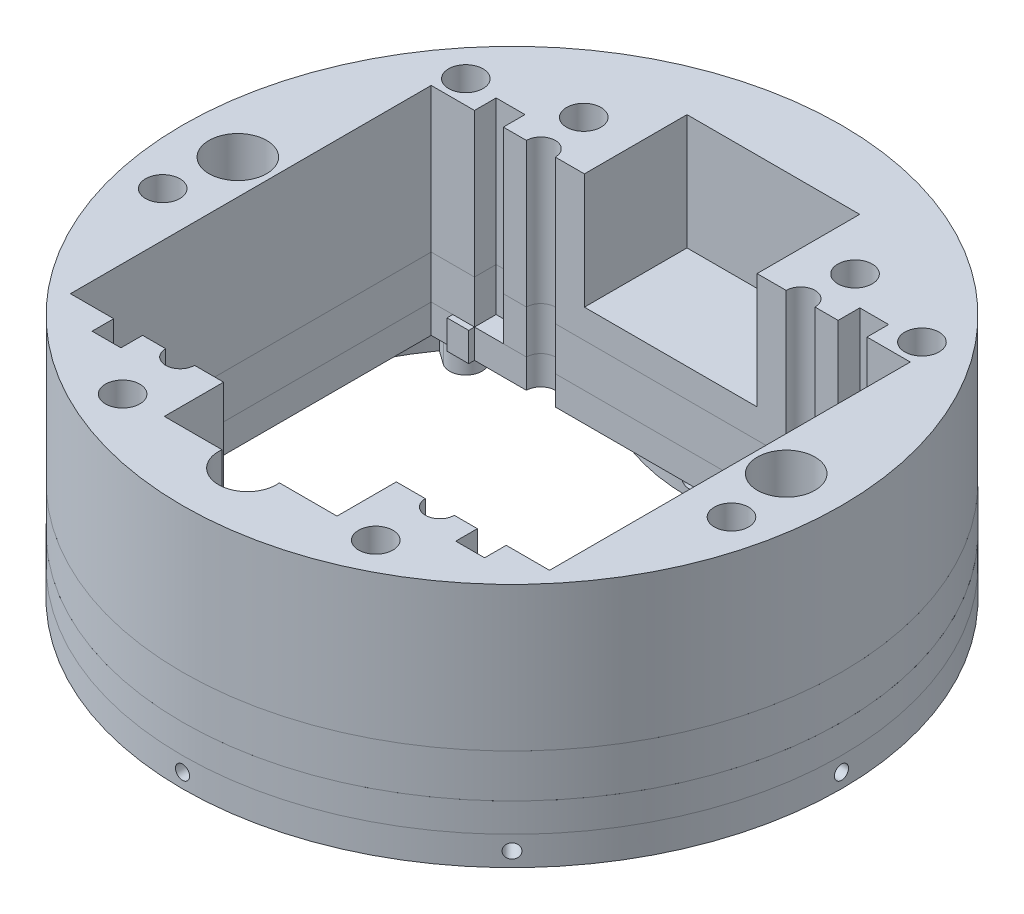
from build123d import *

# Parameters (mm, degrees)
BOSS_EXTRUDE1_DEPTH     = 12.7
CUT_EXTRUDE2_REACH      = 78.233
CUT_EXTRUDE2_END_RADIUS = 44.45
SKETCH9_R               = 1.55
BOSS_EXTRUDE3_START     = -30.48
SKETCH9_3_R             = 2.032
SKETCH9_3_R_2           = 1.55
BOSS_EXTRUDE3_DEPTH     = 4.191
BOSS_EXTRUDE4_DEPTH     = 6.35
SKETCH10_R              = 1.5875
BOSS_EXTRUDE5_DEPTH     = 6.35
SKETCH15_W              = 2.45745
SKETCH15_H              = 6.35
CIRPATTERN7_COUNT       = 7
SKETCH12_R              = 1.55
CUT_EXTRUDE3_DEPTH      = 252.513244882
CIRPATTERN8_COUNT       = 8
SKETCH12_6_R            = 1.55
CUT_EXTRUDE4_DEPTH      = 252.513245008
SKETCH13_R              = 3.556
SKETCH13_R_2            = 2.45745
BOSS_EXTRUDE6_DEPTH     = 6.35
SKETCH17_R              = 6.35
SKETCH17_R_2            = 2.45745
RING1_DEPTH             = 6.35
SKETCH18_R              = 3.7846
SKETCH18_R_2            = 6.35
RING2_DEPTH             = 9.525
RING4_START             = 9.525
SKETCH18_3_R            = 72.5
SKETCH18_3_R_2          = 3.7846
SKETCH18_3_R_3          = 6.35
RING4_DEPTH             = 31.75
SKETCH37_W              = 38
SKETCH37_H              = 115
CUT_EXTRUDE7_DEPTH      = 25.4


with BuildPart() as part:
    # Sketch1 → Boss-Extrude1 (new body)
    with BuildSketch(Plane(origin=(0, 0, 0), x_dir=(1, 0, 0), z_dir=(0, 1, 0))):
        with BuildLine():
            Line((36.108624257, 57.310872969), (38.647355729, 61.340295852))
            ThreePointArc((38.647355729, 61.340295852), (35.938080957, 62.965898208), (33.160552015, 64.471914738))
            ThreePointArc((33.160552015, 64.471914738), (0, 45.133252378), (-33.160552015, 64.471914738))
            ThreePointArc((-33.160552015, 64.471914738), (-35.938080957, 62.965898208), (-38.647355729, 61.340295852))
            Line((-38.647355729, 61.340295852), (-36.108624257, 57.310872969))
            ThreePointArc((-36.108624257, 57.310872969), (0, 38.783252378), (36.108624257, 57.310872969))
        make_face()
    extrude(amount=BOSS_EXTRUDE1_DEPTH)

    # Cut-Extrude2: up to this cylinder (the profile starts inside it)
    cut_extrude2_end = Plane(origin=(0, 9.525, -83.233252378), z_dir=(0, -1, 0)) * Cylinder(CUT_EXTRUDE2_END_RADIUS, 246.366, mode=Mode.PRIVATE)
    # Sketch9 → Cut-Extrude2 (cut, up to the surface)
    with BuildSketch(Plane(origin=(0, 0, 0), x_dir=(0, 0, -1), z_dir=(1, 0, 0)), mode=Mode.PRIVATE) as cut_extrude2_sk1:
        with Locations((53.34, 9.525)):
            Circle(SKETCH9_R)
    cut_extrude2_tool1 = extrude(cut_extrude2_sk1.sketch, amount=-CUT_EXTRUDE2_REACH, mode=Mode.PRIVATE) & cut_extrude2_end
    cut_extrude2 = cut_extrude2_tool1.solids().sort_by_distance((0, 9.525, -53.34))[0]
    add(cut_extrude2, mode=Mode.SUBTRACT)

    # Sketch9<3> → Boss-Extrude3 (add)
    with BuildSketch(Plane(origin=(0, 0, 0), x_dir=(0, 0, -1), z_dir=(1, 0, 0)).offset(BOSS_EXTRUDE3_START)):
        with Locations((53.34, 9.525)):
            Circle(SKETCH9_3_R)
        with Locations((53.34, 9.525)):
            Circle(SKETCH9_3_R_2, mode=Mode.SUBTRACT)
    boss_extrude3 = extrude(amount=-BOSS_EXTRUDE3_DEPTH)

    # Mirror1: Cut-Extrude2, Boss-Extrude3 across plane
    add(cut_extrude2.mirror(Plane(origin=(0, 0, 0), x_dir=(0, 0, 1), z_dir=(1, 0, 0))), mode=Mode.SUBTRACT)
    add(boss_extrude3.mirror(Plane(origin=(0, 0, 0), x_dir=(0, 0, 1), z_dir=(1, 0, 0))))

    # Sketch12<6> → Cut-Extrude4 (cut, through all)
    with BuildSketch(Plane(origin=(-168.002333354, 0, 0), x_dir=(1, 0, 0), z_dir=(0, 0, 1))):
        with Locations(Location((168.002333354, 3.175, 0), (0, 0, 180))):
            Circle(SKETCH12_6_R)
    extrude(amount=-CUT_EXTRUDE4_DEPTH, mode=Mode.SUBTRACT)


with BuildPart() as body_2:
    # Sketch1<4> → Boss-Extrude4 (new body)
    with BuildSketch(Plane(origin=(0, 0, 0), x_dir=(1, 0, 0), z_dir=(0, 1, 0))):
        with BuildLine():
            ThreePointArc((72.5, 0), (63.475126193, 35.030820071), (38.647355729, 61.340295852))
            Line((38.647355729, 61.340295852), (36.108624257, 57.310872969))
            ThreePointArc((36.108624257, 57.310872969), (0, -67.7375), (-36.108624257, 57.310872969))
            Line((-36.108624257, 57.310872969), (-38.647355729, 61.340295852))
            ThreePointArc((-38.647355729, 61.340295852), (-35.030820071, -63.475126193), (72.5, 0))
        make_face()
    extrude(amount=BOSS_EXTRUDE4_DEPTH)

    # Sketch10 → Boss-Extrude5 (add)
    with BuildSketch(Plane(origin=(0, 6.35, 0), x_dir=(1, 0, 0), z_dir=(0, 1, 0))):
        with BuildLine():
            Line((-55.217932138, 39.234536785), (-52.23880377, 37.1177476))
            ThreePointArc((-52.23880377, 37.1177476), (-47.39892454, 37.799380983), (-47.811355577, 42.669592032))
            Line((-47.811355577, 42.669592032), (-50.537990863, 45.102997525))
            ThreePointArc((-50.537990863, 45.102997525), (-52.959310044, 42.233640453), (-55.217932138, 39.234536785))
        make_face()
        with Locations(Location((-50.179117292, 40.016510718, 0), (0, 0, 270))):
            Circle(SKETCH10_R, mode=Mode.SUBTRACT)
    boss_extrude5 = extrude(amount=-BOSS_EXTRUDE5_DEPTH)

    # Sketch15 → #8 Clearance Hole1 (revolve, cut)
    with BuildSketch(Plane(origin=(-50.179117292, 6.35, -40.016510718), x_dir=(0, 0, 1), z_dir=(1, 0, 0))):
        with Locations((1.228725, 3.175)):
            Rectangle(SKETCH15_W, SKETCH15_H)
    f_8_clearance_hole1 = revolve(axis=Axis((-50.179117292, 12.7, -40.016510718), (0, -1, 0)), mode=Mode.SUBTRACT)

    # CirPattern7: Boss-Extrude5, #8 Clearance Hole1 ×7 about axis, 1 skipped
    cirpattern7_axis = Axis((0, 0, 0), (0, 1, 0))
    add([boss_extrude5.rotate(cirpattern7_axis, i * 360 / CIRPATTERN7_COUNT) for i in range(1, CIRPATTERN7_COUNT) if i not in (6,)])
    add([f_8_clearance_hole1.rotate(cirpattern7_axis, i * 360 / CIRPATTERN7_COUNT) for i in range(1, CIRPATTERN7_COUNT) if i not in (6,)], mode=Mode.SUBTRACT)

    # Sketch12 → Cut-Extrude3 (cut, through all)
    with BuildSketch(Plane(origin=(-168.002333354, 0, 0), x_dir=(1, 0, 0), z_dir=(0, 0, 1))):
        with Locations(Location((168.002333354, 3.175, 0), (0, 0, 180))):
            Circle(SKETCH12_R)
    cut_extrude3 = extrude(amount=CUT_EXTRUDE3_DEPTH, mode=Mode.SUBTRACT)

    # CirPattern8: Cut-Extrude3 ×8 about axis
    cirpattern8_axis = Axis((0, 6.35, 0), (0, 1, 0))
    for i in range(1, CIRPATTERN8_COUNT):
        add(cut_extrude3.rotate(cirpattern8_axis, i * 360 / CIRPATTERN8_COUNT), mode=Mode.SUBTRACT)


    add(part.part)  # Boss-Extrude6 merges part
    # Sketch13 → Boss-Extrude6 (add)
    # profile 1 of 3: a face of its own
    with BuildSketch(Plane(origin=(0, 0, 0), x_dir=(1, 0, 0), z_dir=(0, 1, 0))):
        with BuildLine():
            ThreePointArc((-26.289, 45.632028848), (-26.48720483, 44.46141038), (-27.059724183, 43.421288107))
            Line((-27.059724183, 43.421288107), (-24.760411871, 46.318153787))
            ThreePointArc((-24.760411871, 46.318153787), (-26.218352211, 47.338956072), (-27.634259014, 48.417304471))
            ThreePointArc((-27.634259014, 48.417304471), (-26.642927941, 47.178596185), (-26.289, 45.632028848))
        make_face()
    # profile 2 of 3: a face of its own
    with BuildSketch(Plane(origin=(0, 0, 0), x_dir=(1, 0, 0), z_dir=(0, 1, 0))):
        with Locations((-29.845, 45.632028848)):
            Circle(SKETCH13_R)
        with Locations(Location((-29.845, 45.632028848, 0), (0, 0, 270))):
            Circle(SKETCH13_R_2, mode=Mode.SUBTRACT)
    # profile 3 of 3: a face of its own
    with BuildSketch(Plane(origin=(0, 0, 0), x_dir=(1, 0, 0), z_dir=(0, 1, 0))):
        with BuildLine():
            Line((-30.330963505, 50.739635269), (-32.630275817, 47.842769588))
            ThreePointArc((-32.630275817, 47.842769588), (-30.251257493, 49.164746053), (-27.634259014, 48.417304471))
            ThreePointArc((-27.634259014, 48.417304471), (-29.00586252, 49.551470367), (-30.330963505, 50.739635269))
        make_face()
    boss_extrude6 = extrude(amount=BOSS_EXTRUDE6_DEPTH)

    # Mirror2: Boss-Extrude6 across plane
    add(boss_extrude6.mirror(Plane(origin=(0, 0, 0), x_dir=(0, 0, 1), z_dir=(1, 0, 0))))


with BuildPart() as body_2_2:
    # Sketch17 → Ring1 (new body)
    with BuildSketch(Plane(origin=(0, 6.35, 0), x_dir=(1, 0, 0), z_dir=(0, 1, 0))):
        with BuildLine():
            Line((-32.630275817, 47.842769588), (-47.952458794, 47.842769588))
            ThreePointArc((-47.952458794, 47.842769588), (-42.296307952, 52.909273666), (-36.108624257, 57.310872969))
            Line((-36.108624257, 57.310872969), (-38.647355729, 61.340295852))
            ThreePointArc((-38.647355729, 61.340295852), (0, -72.5), (38.647355729, 61.340295852))
            Line((38.647355729, 61.340295852), (36.108624257, 57.310872969))
            ThreePointArc((36.108624257, 57.310872969), (42.296307952, 52.909273666), (47.952458794, 47.842769588))
            Line((47.952458794, 47.842769588), (32.630275817, 47.842769588))
            Line((32.630275817, 47.842769588), (30.330963505, 50.739635269))
            ThreePointArc((30.330963505, 50.739635269), (0, 38.783252378), (-30.330963505, 50.739635269))
            Line((-30.330963505, 50.739635269), (-32.630275817, 47.842769588))
        make_face()
        with BuildLine():
            Line((52.705, 34.925), (52.705, -42.550580269))
            ThreePointArc((52.705, -42.550580269), (51.917822216, -43.507569946), (51.113270354, -44.45))
            Line((51.113270354, -44.45), (47.9425, -44.45))
            Line((47.9425, -44.45), (47.9425, -43.18))
            Line((47.9425, -43.18), (43.18, -43.18))
            Line((43.18, -43.18), (43.18, -44.45))
            Line((43.18, -44.45), (31.75, -44.45))
            ThreePointArc((31.75, -44.45), (28.575, -47.625), (25.4, -44.45))
            Line((25.4, -44.45), (-25.4, -44.45))
            ThreePointArc((-25.4, -44.45), (-28.575, -47.625), (-31.75, -44.45))
            Line((-31.75, -44.45), (-43.18, -44.45))
            Line((-43.18, -44.45), (-43.18, -43.18))
            Line((-43.18, -43.18), (-47.9425, -43.18))
            Line((-47.9425, -43.18), (-47.9425, -44.45))
            Line((-47.9425, -44.45), (-51.113270354, -44.45))
            ThreePointArc((-51.113270354, -44.45), (-51.917822216, -43.507569946), (-52.705, -42.550580269))
            Line((-52.705, -42.550580269), (-52.705, 34.925))
            Line((-52.705, 34.925), (-47.9425, 34.925))
            Line((-47.9425, 34.925), (-47.9425, 33.655))
            Line((-47.9425, 33.655), (-43.18, 33.655))
            Line((-43.18, 33.655), (-43.18, 34.925))
            Line((-43.18, 34.925), (-31.75, 34.925))
            ThreePointArc((-31.75, 34.925), (-28.575, 38.1), (-25.4, 34.925))
            Line((-25.4, 34.925), (25.4, 34.925))
            ThreePointArc((25.4, 34.925), (28.575, 38.1), (31.75, 34.925))
            Line((31.75, 34.925), (43.18, 34.925))
            Line((43.18, 34.925), (43.18, 33.655))
            Line((43.18, 33.655), (47.9425, 33.655))
            Line((47.9425, 33.655), (47.9425, 34.925))
            Line((47.9425, 34.925), (52.705, 34.925))
        make_face(mode=Mode.SUBTRACT)
        with Locations(Location((-60.325, 0, 0), (0, 0, 270))):
            Circle(SKETCH17_R, mode=Mode.SUBTRACT)
        with Locations(Location((60.325, 0, 0), (0, 0, 270))):
            Circle(SKETCH17_R, mode=Mode.SUBTRACT)
        with Locations(Location((62.572335796, -14.281727323, 0), (0, 0, 270))):
            Circle(SKETCH17_R_2, mode=Mode.SUBTRACT)
        with Locations(Location((-50.179117292, 40.016510718, 0), (0, 0, 270))):
            Circle(SKETCH17_R_2, mode=Mode.SUBTRACT)
        with Locations(Location((50.179117292, 40.016510718, 0), (0, 0, 270))):
            Circle(SKETCH17_R_2, mode=Mode.SUBTRACT)
        with Locations(Location((-27.847309202, -57.825533395, 0), (0, 0, 270))):
            Circle(SKETCH17_R_2, mode=Mode.SUBTRACT)
        with Locations(Location((-62.572335796, -14.281727323, 0), (0, 0, 270))):
            Circle(SKETCH17_R_2, mode=Mode.SUBTRACT)
        with Locations(Location((27.847309202, -57.825533395, 0), (0, 0, 270))):
            Circle(SKETCH17_R_2, mode=Mode.SUBTRACT)
        with Locations(Location((0, -58.2125, 0), (0, 0, 270))):
            Circle(SKETCH17_R, mode=Mode.SUBTRACT)
        with Locations(Location((-29.845, 45.632028848, 0), (0, 0, 270))):
            Circle(SKETCH17_R_2, mode=Mode.SUBTRACT)
        with Locations(Location((29.845, 45.632028848, 0), (0, 0, 270))):
            Circle(SKETCH17_R_2, mode=Mode.SUBTRACT)
    extrude(amount=RING1_DEPTH)


with BuildPart() as body_3:
    # Sketch18 → Ring2 (new body)
    with BuildSketch(Plane(origin=(0, 12.7, 0), x_dir=(1, 0, 0), z_dir=(0, 1, 0))):
        with BuildLine():
            ThreePointArc((-38.647355729, 61.340295852), (0, -72.5), (38.647355729, 61.340295852))
            ThreePointArc((38.647355729, 61.340295852), (35.938080957, 62.965898208), (33.160552015, 64.471914738))
            ThreePointArc((33.160552015, 64.471914738), (0, 45.133252378), (-33.160552015, 64.471914738))
            ThreePointArc((-33.160552015, 64.471914738), (-35.938080957, 62.965898208), (-38.647355729, 61.340295852))
        make_face()
        with Locations(Location((-27.847309202, -57.825533395, 0), (0, 0, 90))):
            Circle(SKETCH18_R, mode=Mode.SUBTRACT)
        with Locations(Location((0, -58.2125, 0), (0, 0, 90))):
            Circle(SKETCH18_R_2, mode=Mode.SUBTRACT)
        with Locations(Location((-62.572335796, -14.281727323, 0), (0, 0, 90))):
            Circle(SKETCH18_R, mode=Mode.SUBTRACT)
        with BuildLine():
            Line((-52.705, -44.45), (-52.705, 34.925))
            Line((-52.705, 34.925), (-43.18, 34.925))
            Line((-43.18, 34.925), (-43.18, 39.6875))
            Line((-43.18, 39.6875), (-36.83, 39.6875))
            Line((-36.83, 39.6875), (-36.83, 34.925))
            Line((-36.83, 34.925), (-31.75, 34.925))
            ThreePointArc((-31.75, 34.925), (-28.575, 38.1), (-25.4, 34.925))
            Line((-25.4, 34.925), (25.4, 34.925))
            ThreePointArc((25.4, 34.925), (28.575, 38.1), (31.75, 34.925))
            Line((31.75, 34.925), (36.83, 34.925))
            Line((36.83, 34.925), (36.83, 39.6875))
            Line((36.83, 39.6875), (43.18, 39.6875))
            Line((43.18, 39.6875), (43.18, 34.925))
            Line((43.18, 34.925), (52.705, 34.925))
            Line((52.705, 34.925), (52.705, -44.45))
            Line((52.705, -44.45), (43.18, -44.45))
            Line((43.18, -44.45), (43.18, -49.2125))
            Line((43.18, -49.2125), (36.83, -49.2125))
            Line((36.83, -49.2125), (36.83, -44.45))
            Line((36.83, -44.45), (31.75, -44.45))
            ThreePointArc((31.75, -44.45), (28.575, -47.625), (25.4, -44.45))
            Line((25.4, -44.45), (-25.4, -44.45))
            ThreePointArc((-25.4, -44.45), (-28.575, -47.625), (-31.75, -44.45))
            Line((-31.75, -44.45), (-36.83, -44.45))
            Line((-36.83, -44.45), (-36.83, -49.2125))
            Line((-36.83, -49.2125), (-43.18, -49.2125))
            Line((-43.18, -49.2125), (-43.18, -44.45))
            Line((-43.18, -44.45), (-52.705, -44.45))
        make_face(mode=Mode.SUBTRACT)
        with Locations(Location((27.847309202, -57.825533395, 0), (0, 0, 90))):
            Circle(SKETCH18_R, mode=Mode.SUBTRACT)
        with Locations(Location((62.572335796, -14.281727323, 0), (0, 0, 90))):
            Circle(SKETCH18_R, mode=Mode.SUBTRACT)
        with Locations(Location((-60.325, 0, 0), (0, 0, 90))):
            Circle(SKETCH18_R_2, mode=Mode.SUBTRACT)
        with Locations(Location((-50.179117292, 40.016510718, 0), (0, 0, 90))):
            Circle(SKETCH18_R, mode=Mode.SUBTRACT)
        with Locations(Location((-29.845, 45.632028848, 0), (0, 0, 90))):
            Circle(SKETCH18_R, mode=Mode.SUBTRACT)
        with Locations(Location((60.325, 0, 0), (0, 0, 90))):
            Circle(SKETCH18_R_2, mode=Mode.SUBTRACT)
        with Locations(Location((29.845, 45.632028848, 0), (0, 0, 90))):
            Circle(SKETCH18_R, mode=Mode.SUBTRACT)
        with Locations(Location((50.179117292, 40.016510718, 0), (0, 0, 90))):
            Circle(SKETCH18_R, mode=Mode.SUBTRACT)
    extrude(amount=RING2_DEPTH)


with BuildPart() as body_4:
    # Sketch18<3> → Ring4 (new body)
    with BuildSketch(Plane(origin=(0, 12.7, 0), x_dir=(1, 0, 0), z_dir=(0, 1, 0)).offset(RING4_START)):
        with Locations(Location((0, 0, 0), (0, 0, 270))):
            Circle(SKETCH18_3_R)
        with Locations(Location((-27.847309202, -57.825533395, 0), (0, 0, 270))):
            Circle(SKETCH18_3_R_2, mode=Mode.SUBTRACT)
        with Locations(Location((0, -58.2125, 0), (0, 0, 270))):
            Circle(SKETCH18_3_R_3, mode=Mode.SUBTRACT)
        with Locations(Location((-62.572335796, -14.281727323, 0), (0, 0, 270))):
            Circle(SKETCH18_3_R_2, mode=Mode.SUBTRACT)
        with BuildLine():
            Line((-52.705, -44.45), (-52.705, 34.925))
            Line((-52.705, 34.925), (-43.18, 34.925))
            Line((-43.18, 34.925), (-43.18, 39.6875))
            Line((-43.18, 39.6875), (-36.83, 39.6875))
            Line((-36.83, 39.6875), (-36.83, 34.925))
            Line((-36.83, 34.925), (-31.75, 34.925))
            ThreePointArc((-31.75, 34.925), (-28.575, 38.1), (-25.4, 34.925))
            Line((-25.4, 34.925), (25.4, 34.925))
            ThreePointArc((25.4, 34.925), (28.575, 38.1), (31.75, 34.925))
            Line((31.75, 34.925), (36.83, 34.925))
            Line((36.83, 34.925), (36.83, 39.6875))
            Line((36.83, 39.6875), (43.18, 39.6875))
            Line((43.18, 39.6875), (43.18, 34.925))
            Line((43.18, 34.925), (52.705, 34.925))
            Line((52.705, 34.925), (52.705, -44.45))
            Line((52.705, -44.45), (43.18, -44.45))
            Line((43.18, -44.45), (43.18, -49.2125))
            Line((43.18, -49.2125), (36.83, -49.2125))
            Line((36.83, -49.2125), (36.83, -44.45))
            Line((36.83, -44.45), (31.75, -44.45))
            ThreePointArc((31.75, -44.45), (28.575, -47.625), (25.4, -44.45))
            Line((25.4, -44.45), (-25.4, -44.45))
            ThreePointArc((-25.4, -44.45), (-28.575, -47.625), (-31.75, -44.45))
            Line((-31.75, -44.45), (-36.83, -44.45))
            Line((-36.83, -44.45), (-36.83, -49.2125))
            Line((-36.83, -49.2125), (-43.18, -49.2125))
            Line((-43.18, -49.2125), (-43.18, -44.45))
            Line((-43.18, -44.45), (-52.705, -44.45))
        make_face(mode=Mode.SUBTRACT)
        with Locations(Location((27.847309202, -57.825533395, 0), (0, 0, 270))):
            Circle(SKETCH18_3_R_2, mode=Mode.SUBTRACT)
        with Locations(Location((62.572335796, -14.281727323, 0), (0, 0, 270))):
            Circle(SKETCH18_3_R_2, mode=Mode.SUBTRACT)
        with Locations(Location((-60.325, 0, 0), (0, 0, 270))):
            Circle(SKETCH18_3_R_3, mode=Mode.SUBTRACT)
        with Locations(Location((-50.179117292, 40.016510718, 0), (0, 0, 270))):
            Circle(SKETCH18_3_R_2, mode=Mode.SUBTRACT)
        with Locations(Location((-29.845, 45.632028848, 0), (0, 0, 270))):
            Circle(SKETCH18_3_R_2, mode=Mode.SUBTRACT)
        with Locations(Location((60.325, 0, 0), (0, 0, 270))):
            Circle(SKETCH18_3_R_3, mode=Mode.SUBTRACT)
        with Locations(Location((29.845, 45.632028848, 0), (0, 0, 270))):
            Circle(SKETCH18_3_R_2, mode=Mode.SUBTRACT)
        with Locations(Location((50.179117292, 40.016510718, 0), (0, 0, 270))):
            Circle(SKETCH18_3_R_2, mode=Mode.SUBTRACT)
    extrude(amount=RING4_DEPTH)

    # Sketch37 → Cut-Extrude7 (cut)
    with BuildSketch(Plane(origin=(0, 53.975, 0), x_dir=(1, 0, 0), z_dir=(0, 1, 0))):
        Rectangle(SKETCH37_W, SKETCH37_H)
    extrude(amount=-CUT_EXTRUDE7_DEPTH, mode=Mode.SUBTRACT)


solid = Compound([body_2.part, body_2_2.part, body_3.part, body_4.part])
